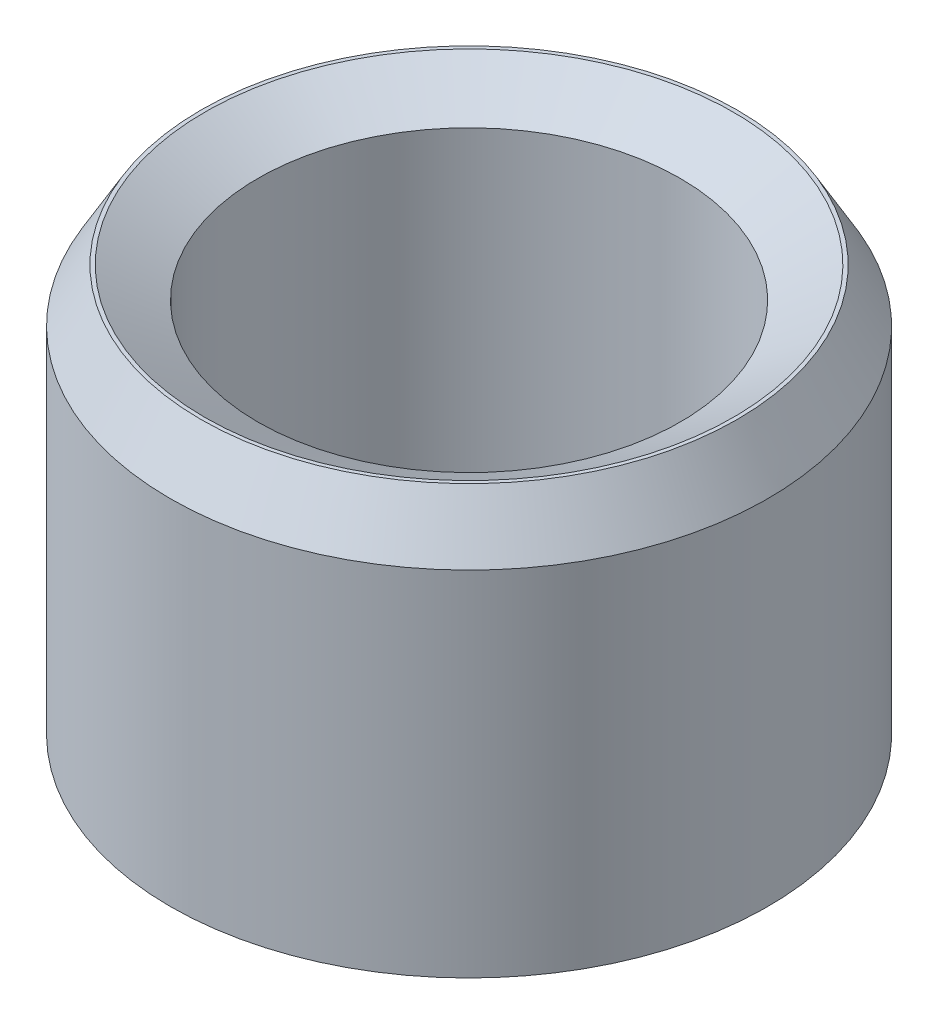
from build123d import *
from OCP.BRepFilletAPI import BRepFilletAPI_MakeChamfer

# Parameters (mm, degrees)
SKETCH1_R           = 12.5
BOSS_EXTRUDE1_DEPTH = 18.287337335
SKETCH2_R           = 8.833489993
CUT_EXTRUDE1_DEPTH  = 26.434753917
CHAMFER1_SIZE       = 2.22529106
CHAMFER1_SIZE2      = 1.284772393


with BuildPart() as part:
    # Sketch1 → Boss-Extrude1 (new body)
    with BuildSketch(Plane(origin=(0, 0, 0), x_dir=(1, 0, 0), z_dir=(0, 1, 0))):
        Circle(SKETCH1_R)
    extrude(amount=BOSS_EXTRUDE1_DEPTH)

    # Sketch2 → Cut-Extrude1 (cut, through all)
    with BuildSketch(Plane(origin=(0, 0, 0), x_dir=(1, 0, 0), z_dir=(0, 1, 0))):
        Circle(SKETCH2_R)
    extrude(amount=CUT_EXTRUDE1_DEPTH, mode=Mode.SUBTRACT)

    # Chamfer1: one chamfer whose edges measure the first distance from different faces: ONE call of the kernel's chamfer builder (chamfer() names one face for all edges)
    chamfer1_edges_1 = [part.edges().sort_by_distance(p)[0] for p in [
        (-8.833489993, 18.287337335, 0),
    ]]
    chamfer1_side_1 = [part.faces().sort_by_distance(p)[0] for p in [
        (-12.146446609, 18.287337335, 0),
    ]]
    chamfer1_edges_2 = [part.edges().sort_by_distance(p)[0] for p in [
        (-8.833489993, 0, 0),
    ]]
    chamfer1_side_2 = [part.faces().sort_by_distance(p)[0] for p in [
        (-8.833489993, 9.143668668, 0),
    ]]
    chamfer1_edges_3 = [part.edges().sort_by_distance(p)[0] for p in [
        (-12.5, 0, 0),
    ]]
    chamfer1_side_3 = [part.faces().sort_by_distance(p)[0] for p in [
        (-12.146446609, 0, 0),
    ]]
    chamfer1_edges_4 = [part.edges().sort_by_distance(p)[0] for p in [
        (-12.5, 18.287337335, 0),
    ]]
    chamfer1_side_4 = [part.faces().sort_by_distance(p)[0] for p in [
        (-12.5, 9.143668668, 0),
    ]]
    chamfer1 = BRepFilletAPI_MakeChamfer(part.part.solid().wrapped)
    for e in chamfer1_edges_1:
        chamfer1.Add(CHAMFER1_SIZE, CHAMFER1_SIZE2, e.wrapped, chamfer1_side_1[0].wrapped)  # the first distance lies on this face
    for e in chamfer1_edges_2:
        chamfer1.Add(CHAMFER1_SIZE, CHAMFER1_SIZE2, e.wrapped, chamfer1_side_2[0].wrapped)  # the first distance lies on this face
    for e in chamfer1_edges_3:
        chamfer1.Add(CHAMFER1_SIZE, CHAMFER1_SIZE2, e.wrapped, chamfer1_side_3[0].wrapped)  # the first distance lies on this face
    for e in chamfer1_edges_4:
        chamfer1.Add(CHAMFER1_SIZE, CHAMFER1_SIZE2, e.wrapped, chamfer1_side_4[0].wrapped)  # the first distance lies on this face
    add(Compound.cast(chamfer1.Shape()), mode=Mode.REPLACE)


solid = part.part
